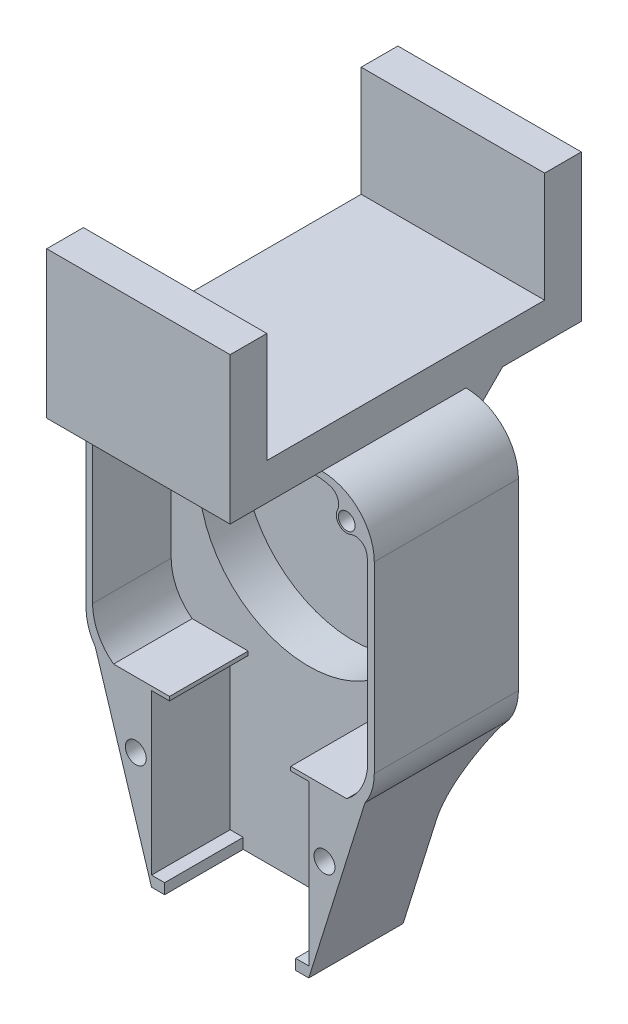
from build123d import *

# Parameters (mm, degrees)
CROQUIS4_R                  = 2.5
SALIENTE_EXTRUIR1_DEPTH     = 4
CROQUIS5_R                  = 21
SALIENTE_EXTRUIR2_DEPTH     = 8.5
SALIENTE_EXTRUIR4_START     = -3
SALIENTE_EXTRUIR4_DEPTH     = 3
REDONDEO1_R                 = 10
SALIENTE_EXTRUIR5_OUTLINE_R = 2
SALIENTE_EXTRUIR5_DEPTH     = 15
CROQUIS9_R                  = 1.6
CORTAR_EXTRUIR1_DEPTH       = 70.417217007
CROQUIS11_W                 = 35
CROQUIS11_H                 = 53
SALIENTE_EXTRUIR7_DEPTH     = 7
CROQUIS12_W                 = 35
CROQUIS12_H                 = 7
SALIENTE_EXTRUIR8_DEPTH     = 28
CHAFL_N2_SIZE               = 7
CROQUIS13_R                 = 11.4
CORTAR_EXTRUIR2_DEPTH       = 2


# Read off the part's stored shape, not the designer's step: Saliente-Extruir5
with BuildPart() as part:
    # Croquis4 → Saliente-Extruir1 (new body)
    with BuildSketch(Plane.XY):
        with BuildLine():
            Line((-17.5, 27.5), (17.5, 27.5))
            ThreePointArc((17.5, 27.5), (24.571067812, 24.571067812), (27.5, 17.5))
            Line((27.5, 17.5), (27.5, -17.5))
            ThreePointArc((27.5, -17.5), (24.571067812, -24.571067812), (17.5, -27.5))
            Line((17.5, -27.5), (-17.5, -27.5))
            ThreePointArc((-17.5, -27.5), (-24.571067812, -24.571067812), (-27.5, -17.5))
            Line((-27.5, -17.5), (-27.5, 17.5))
            ThreePointArc((-27.5, 17.5), (-24.571067812, 24.571067812), (-17.5, 27.5))
        make_face()
        Circle(CROQUIS4_R, mode=Mode.SUBTRACT)
    extrude(amount=SALIENTE_EXTRUIR1_DEPTH)

    # Croquis5 → Saliente-Extruir2 (add)
    with BuildSketch(Plane.XY.offset(4)):
        with BuildLine():
            Line((-17.5, 27.5), (17.5, 27.5))
            ThreePointArc((17.5, 27.5), (24.571067812, 24.571067812), (27.5, 17.5))
            Line((27.5, 17.5), (27.5, -17.5))
            ThreePointArc((27.5, -17.5), (24.571067812, -24.571067812), (17.5, -27.5))
            Line((17.5, -27.5), (-17.5, -27.5))
            ThreePointArc((-17.5, -27.5), (-24.571067812, -24.571067812), (-27.5, -17.5))
            Line((-27.5, -17.5), (-27.5, 17.5))
            ThreePointArc((-27.5, 17.5), (-24.571067812, 24.571067812), (-17.5, 27.5))
        make_face()
        Circle(CROQUIS5_R, mode=Mode.SUBTRACT)
    extrude(amount=SALIENTE_EXTRUIR2_DEPTH)

    # Croquis6 → Saliente-Extruir4 (add)
    with BuildSketch(Plane.XY.offset(12.5).offset(SALIENTE_EXTRUIR4_START)):
        with BuildLine():
            Line((-25.720640569, -23.193950178), (-15, -57.5))
            Line((-15, -57.5), (15, -57.5))
            Line((15, -57.5), (25.720640569, -23.193950178))
            ThreePointArc((25.720640569, -23.193950178), (22.140069947, -26.358315353), (17.5, -27.5))
            Line((17.5, -27.5), (-17.5, -27.5))
            ThreePointArc((-17.5, -27.5), (-22.140069947, -26.358315353), (-25.720640569, -23.193950178))
        make_face()
    extrude(amount=SALIENTE_EXTRUIR4_DEPTH)

    # Redondeo1
    # the kernel refuses this fillet: 10 mm, written as the material it adds along each edge
    with BuildSketch(Plane(origin=(17.5, -17.5, 9.5), x_dir=(-0.31521717271258337, 0.949019564617656, 0), z_dir=(-0.949019564617656, -0.31521717271258337, 0))) as redondeo1_piece_1_section:
        with BuildLine():
            CenterArc((19.987492178, 10), REDONDEO1_R, 182.865983983, 87.134016017)
            Line((19.987492178, 0), (10, 0))
            Line((10, 0), (10, 9.5))
        make_face()
    redondeo1_piece_1 = revolve(axis=Axis((17.5, -17.5, 9.5), (0, 0, -1)), revolution_arc=198.373924806, mode=Mode.PRIVATE)
    redondeo1_piece_1 = split(redondeo1_piece_1, bisect_by=Plane(origin=(27.5, -26.624186886, 2.060383814), z_dir=(-1, 0, 0)), keep=Keep.TOP, mode=Mode.PRIVATE)
    redondeo1_piece_1 = redondeo1_piece_1 - Plane(origin=(0, 0, 2.060383814), x_dir=(1, 0, 0), z_dir=(0, 0, -1)) * Cylinder(21, 80, mode=Mode.PRIVATE)
    redondeo1_piece_1 = split(redondeo1_piece_1, bisect_by=Plane(origin=(24.437894836, -27.298736526, 2.060383814), z_dir=(-0.9544799780350299, 0.2982749931359464, 0)), keep=Keep.TOP, mode=Mode.PRIVATE)
    add(redondeo1_piece_1)
    with BuildSketch(Plane(origin=(-17.5, -17.5, 9.5), x_dir=(0, -1, 0), z_dir=(1, 0, 0))) as redondeo1_piece_2_section:
        with BuildLine():
            CenterArc((19.987492178, 10), REDONDEO1_R, 182.865983983, 87.134016017)
            Line((19.987492178, 0), (10, 0))
            Line((10, 0), (10, 9.5))
        make_face()
    redondeo1_piece_2 = revolve(axis=Axis((-17.5, -17.5, 9.5), (0, 0, -1)), revolution_arc=198.373924806, mode=Mode.PRIVATE)
    redondeo1_piece_2 = split(redondeo1_piece_2, bisect_by=Plane(origin=(-27.5, -26.624186886, 2.060383814), z_dir=(1, 0, 0)), keep=Keep.TOP, mode=Mode.PRIVATE)
    redondeo1_piece_2 = redondeo1_piece_2 - Plane(origin=(0, 0, 2.060383814), x_dir=(1, 0, 0), z_dir=(0, 0, -1)) * Cylinder(21, 80, mode=Mode.PRIVATE)
    redondeo1_piece_2 = split(redondeo1_piece_2, bisect_by=Plane(origin=(-24.437894836, -27.298736526, 2.060383814), z_dir=(0.9544799780350299, 0.29827499313594635, 0)), keep=Keep.TOP, mode=Mode.PRIVATE)
    add(redondeo1_piece_2)
    with BuildSketch(Plane(origin=(17.5, -27.5, 9.5), x_dir=(0, 0, -1), z_dir=(-1, 0, 0))) as redondeo1_piece_3:
        with BuildLine():
            CenterArc((10, 9.987492178), REDONDEO1_R, 180, 87.134016017)
            Line((0, 9.987492178), (0, 0))
            Line((0, 0), (9.5, 0))
        make_face()
    extrude(amount=35)

    # Saliente-Extruir5 outline → Saliente-Extruir5 (add)
    with BuildSketch(Plane.XY.offset(12.5)):
        with BuildLine():
            ThreePointArc((-27.5, -17.5), (-27.04479978, -20.482749931), (-25.720640569, -23.193950178))
            Line((-25.720640569, -23.193950178), (-15, -57.5))
            Line((-15, -57.5), (-12.5, -57.5))
            Line((-12.5, -57.5), (-12.5, -55.5))
            Line((-12.5, -55.5), (-15, -55.5))
            Line((-15, -55.5), (-15, -25))
            Line((-15, -25), (-11.560632513, -25))
            Line((-11.560632513, -25), (-11.560632513, -24.25))
            Line((-11.560632513, -24.25), (-22.25, -24.25))
            ThreePointArc((-22.25, -24.25), (-25.19427191, -20.722135955), (-26.25, -16.25))
            Line((-26.25, -16.25), (-26.25, 16.25))
            ThreePointArc((-26.25, 16.25), (-26.205571214, 17.191595354), (-26.072679638, 18.12482392))
            ThreePointArc((-26.072679638, 18.12482392), (-24.934779512, 19.680078923), (-23.010409798, 19.782235789))
            ThreePointArc((-23.010409798, 19.782235789), (-20.782444846, 20.273260806), (-20.464111601, 22.532375088))
            ThreePointArc((-20.464111601, 22.532375088), (-20.519074057, 24.539569231), (-19.008189542, 25.862096049))
            ThreePointArc((-19.008189542, 25.862096049), (-17.64266642, 26.152549179), (-16.25, 26.25))
            Line((-16.25, 26.25), (16.25, 26.25))
            ThreePointArc((16.25, 26.25), (17.64266642, 26.152549179), (19.008189542, 25.862096049))
            ThreePointArc((19.008189542, 25.862096049), (20.519074057, 24.539569231), (20.464111601, 22.532375088))
            ThreePointArc((20.464111601, 22.532375088), (20.782444846, 20.273260806), (23.010409798, 19.782235789))
            ThreePointArc((23.010409798, 19.782235789), (24.934779512, 19.680078923), (26.072679638, 18.12482392))
            ThreePointArc((26.072679638, 18.12482392), (26.205571214, 17.191595354), (26.25, 16.25))
            Line((26.25, 16.25), (26.25, -16.25))
            ThreePointArc((26.25, -16.25), (25.19427191, -20.722135955), (22.25, -24.25))
            Line((22.25, -24.25), (11.560632513, -24.25))
            Line((11.560632513, -24.25), (11.560632513, -25))
            Line((11.560632513, -25), (15, -25))
            Line((15, -25), (15, -55.5))
            Line((15, -55.5), (12.5, -55.5))
            Line((12.5, -55.5), (12.5, -57.5))
            Line((12.5, -57.5), (15, -57.5))
            Line((15, -57.5), (25.720640569, -23.193950178))
            ThreePointArc((25.720640569, -23.193950178), (27.04479978, -20.482749931), (27.5, -17.5))
            Line((27.5, -17.5), (27.5, 17.5))
            ThreePointArc((27.5, 17.5), (24.571067812, 24.571067812), (17.5, 27.5))
            Line((17.5, 27.5), (-17.5, 27.5))
            ThreePointArc((-17.5, 27.5), (-24.571067812, 24.571067812), (-27.5, 17.5))
            Line((-27.5, 17.5), (-27.5, -17.5))
        make_face()
        with Locations((-18, -36.75)):
            Circle(SALIENTE_EXTRUIR5_OUTLINE_R, mode=Mode.SUBTRACT)
        with Locations((18, -36.75)):
            Circle(SALIENTE_EXTRUIR5_OUTLINE_R, mode=Mode.SUBTRACT)
    extrude(amount=SALIENTE_EXTRUIR5_DEPTH)

    # Croquis9 → Cortar-Extruir1 (cut, through all)
    with BuildSketch(Plane.XY.offset(27.5)):
        with Locations((-22.25, 21.632040357)):
            Circle(CROQUIS9_R)
        with Locations((-18, -36.75)):
            Circle(CROQUIS9_R)
        with Locations((18, -36.75)):
            Circle(CROQUIS9_R)
        with Locations((22.25, 21.632040357)):
            Circle(CROQUIS9_R)
    extrude(amount=-CORTAR_EXTRUIR1_DEPTH, mode=Mode.SUBTRACT)

    # Croquis11 → Saliente-Extruir7 (add)
    with BuildSketch(Plane(origin=(0, 27.5, 0), x_dir=(1, 0, 0), z_dir=(0, 1, 0))):
        with Locations((0, -11.5)):
            Rectangle(CROQUIS11_W, CROQUIS11_H)
    extrude(amount=SALIENTE_EXTRUIR7_DEPTH)

    # Croquis12 → Saliente-Extruir8 (add)
    with BuildSketch(Plane.XZ.offset(-27.5)):
        with Locations((0, 41.5)):
            Rectangle(CROQUIS12_W, CROQUIS12_H)
        with Locations((0, -18.5)):
            Rectangle(CROQUIS12_W, CROQUIS12_H)
    extrude(amount=-SALIENTE_EXTRUIR8_DEPTH)

    # Chaflán2
    chafl_n2_edges = [part.edges().sort_by_distance(p)[0] for p in [
        (0, 27.5, 0),
    ]]
    chamfer(chafl_n2_edges, length=CHAFL_N2_SIZE)

    # Croquis13 → Cortar-Extruir2 (cut)
    with BuildSketch(Plane(origin=(0, 0, 0), x_dir=(-1, 0, 0), z_dir=(0, 0, -1))):
        Circle(CROQUIS13_R)
    extrude(amount=-CORTAR_EXTRUIR2_DEPTH, mode=Mode.SUBTRACT)


solid = part.part
